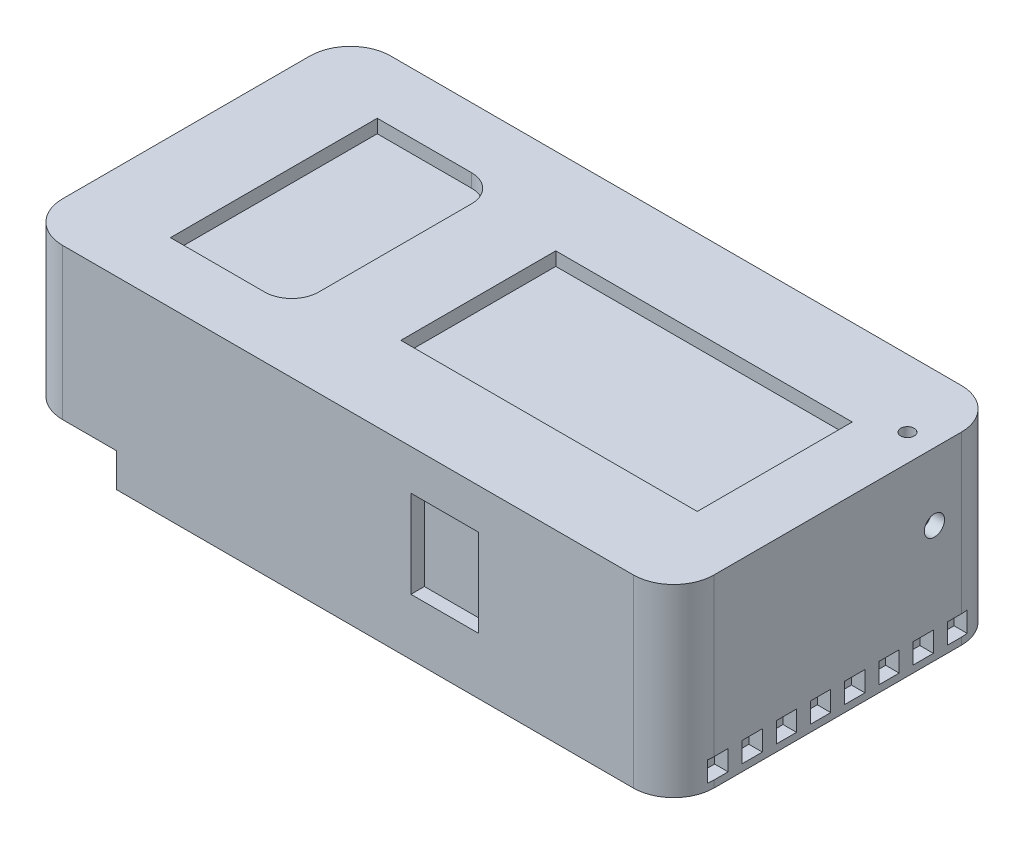
from build123d import *

# Parameters (mm, degrees)
SKETCH1_W           = 48.35
SKETCH1_H           = 24.35
BOSS_EXTRUDE1_DEPTH = 13.7
SKETCH2_R           = 0.5
SKETCH2_W           = 22
SKETCH2_H           = 11.5
CUT_EXTRUDE1_DEPTH  = 1
SKETCH3_W           = 5
SKETCH3_H           = 6.5
CUT_EXTRUDE2_DEPTH  = 1
SKETCH4_R           = 0.75
SKETCH4_W           = 1.5
SKETCH4_H           = 1.5
CUT_EXTRUDE3_DEPTH  = 1
SKETCH5_W           = 5
SKETCH5_H           = 6.5
CUT_EXTRUDE4_DEPTH  = 1
SKETCH6_R           = 1
SKETCH6_W           = 7
SKETCH6_H           = 24.35
CUT_EXTRUDE5_DEPTH  = 2.5
SKETCH7_W           = 10
SKETCH7_H           = 5.15
CUT_EXTRUDE6_DEPTH  = 1
FILLET1_R           = 3


with BuildPart() as part:
    # Sketch1 → Boss-Extrude1 (new body)
    with BuildSketch(Plane(origin=(0, 0, 0), x_dir=(1, 0, 0), z_dir=(0, 1, 0))):
        with Locations((24.175, 12.175)):
            Rectangle(SKETCH1_W, SKETCH1_H)
    extrude(amount=BOSS_EXTRUDE1_DEPTH)

    # Sketch2 → Cut-Extrude1 (cut)
    with BuildSketch(Plane(origin=(0, 13.7, 0), x_dir=(1, 0, 0), z_dir=(0, 1, 0))):
        with Locations(Location((46.35, 19.35, 0), (0, 0, 270))):
            Circle(SKETCH2_R)
        with BuildLine():
            Line((6.5, 19.85), (6.5, 4.5))
            Line((6.5, 4.5), (13.5, 4.5))
            ThreePointArc((13.5, 4.5), (14.914213562, 5.085786438), (15.5, 6.5))
            Line((15.5, 6.5), (15.5, 17.85))
            ThreePointArc((15.5, 17.85), (14.914213562, 19.264213562), (13.5, 19.85))
            Line((13.5, 19.85), (6.5, 19.85))
        make_face()
        with Locations((32.65, 12.2)):
            Rectangle(SKETCH2_W, SKETCH2_H)
    extrude(amount=-CUT_EXTRUDE1_DEPTH, mode=Mode.SUBTRACT)

    # Sketch3 → Cut-Extrude2 (cut)
    with BuildSketch(Plane(origin=(0, 0, -24.35), x_dir=(-1, 0, 0), z_dir=(0, 0, -1))):
        with Locations((-9.5, 7.95)):
            Rectangle(SKETCH3_W, SKETCH3_H)
    extrude(amount=-CUT_EXTRUDE2_DEPTH, mode=Mode.SUBTRACT)

    # Sketch4 → Cut-Extrude3 (cut)
    with BuildSketch(Plane(origin=(48.35, 0, 0), x_dir=(0, 0, -1), z_dir=(1, 0, 0))):
        with Locations((19.35, 8.7)):
            Circle(SKETCH4_R)
        with Locations((5.828571429, 1.27)):
            Rectangle(SKETCH4_W, SKETCH4_H)
        with Locations((3.29, 1.27)):
            Rectangle(SKETCH4_W, SKETCH4_H)
        with Locations((8.367142857, 1.27)):
            Rectangle(SKETCH4_W, SKETCH4_H)
        with Locations((10.905714286, 1.27)):
            Rectangle(SKETCH4_W, SKETCH4_H)
        with Locations((13.444285714, 1.27)):
            Rectangle(SKETCH4_W, SKETCH4_H)
        with Locations((15.982857143, 1.27)):
            Rectangle(SKETCH4_W, SKETCH4_H)
        with Locations((18.521428571, 1.27)):
            Rectangle(SKETCH4_W, SKETCH4_H)
        with Locations((21.06, 1.27)):
            Rectangle(SKETCH4_W, SKETCH4_H)
    extrude(amount=-CUT_EXTRUDE3_DEPTH, mode=Mode.SUBTRACT)

    # Sketch5 → Cut-Extrude4 (cut)
    with BuildSketch(Plane.XY):
        with Locations((31.35, 7.45)):
            Rectangle(SKETCH5_W, SKETCH5_H)
    extrude(amount=-CUT_EXTRUDE4_DEPTH, mode=Mode.SUBTRACT)

    # Sketch6 → Cut-Extrude5 (cut)
    with BuildSketch(Plane.XZ):
        with Locations(Location((9, -4, 0), (0, 0, 270))):
            Circle(SKETCH6_R)
        with Locations(Location((9, -20.35, 0), (0, 0, 270))):
            Circle(SKETCH6_R)
        with Locations((3.5, -12.175)):
            Rectangle(SKETCH6_W, SKETCH6_H)
    extrude(amount=-CUT_EXTRUDE5_DEPTH, mode=Mode.SUBTRACT)

    # Sketch7 → Cut-Extrude6 (cut)
    with BuildSketch(Plane.ZY):
        with BuildLine():
            Line((-15.175, 11.7), (-9.175, 11.7))
            ThreePointArc((-9.175, 11.7), (-7.675, 10.2), (-9.175, 8.7))
            Line((-9.175, 8.7), (-15.175, 8.7))
            ThreePointArc((-15.175, 8.7), (-16.675, 10.2), (-15.175, 11.7))
        make_face()
        with Locations((-12.175, 5.075)):
            Rectangle(SKETCH7_W, SKETCH7_H)
    extrude(amount=-CUT_EXTRUDE6_DEPTH, mode=Mode.SUBTRACT)

    # Fillet1
    # the kernel refuses this fillet: 3 mm, written as the material it takes off along each edge
    with BuildSketch(Plane(origin=(0, -5, -24.35), x_dir=(0, 0, 1), z_dir=(0, 1, 0)), Plane(origin=(0, -5, 0), x_dir=(1, 0, 0), z_dir=(0, 1, 0))) as fillet1_piece_1:
        with BuildLine():
            CenterArc((FILLET1_R, FILLET1_R), FILLET1_R, 180, 90)
            Line((0, FILLET1_R), (0, 0))
            Line((0, 0), (FILLET1_R, 0))
        make_face()
    extrude(amount=26.2, mode=Mode.SUBTRACT)
    with BuildSketch(Plane(origin=(48.35, -7.5, -24.35), x_dir=(0, 0, 1), z_dir=(0, 1, 0)), Plane(origin=(48.35, -7.5, 0), x_dir=(-1, 0, 0), z_dir=(0, 1, 0))) as fillet1_piece_2:
        with BuildLine():
            CenterArc((FILLET1_R, -FILLET1_R), FILLET1_R, 90, 90)
            Line((0, -FILLET1_R), (0, 0))
            Line((0, 0), (FILLET1_R, 0))
        make_face()
    extrude(amount=28.7, mode=Mode.SUBTRACT)


solid = part.part
